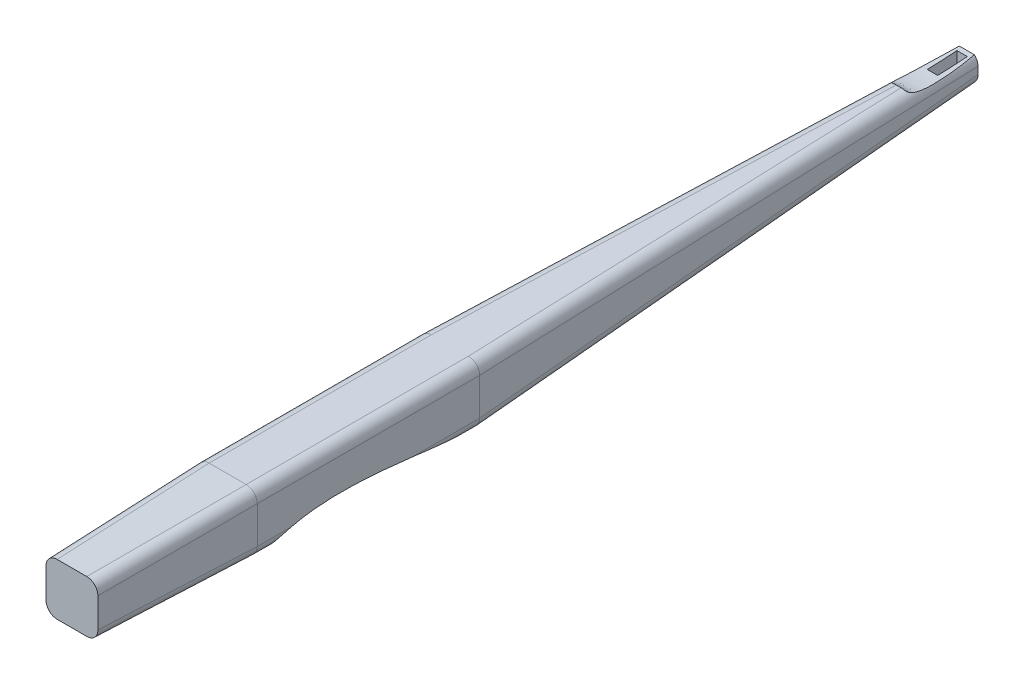
from build123d import *

# Parameters (mm, degrees)
BOSS_EXTRUDE1_DEPTH     = 381
FILLET1_R               = 19.05
CUT_EXTRUDE1_DEPTH      = 1272.5280592341621
CUT_EXTRUDE2_DEPTH      = 1269.4800690080208
CUT_EXTRUDE2_DEPTH_BACK = 1269.4800690080208
CUT_EXTRUDE3_DEPTH      = 37.337999999999994


with BuildPart() as part:
    # Sketch1 → Boss-Extrude1 (new body)
    with BuildSketch(Plane.XY):
        Polygon((50.8, -50.800000000000004), (-50.79999999999999, -50.80000000000001), (-50.79999999999999, 50.79999999999998), (50.800000000000004, 50.79999999999999), align=None)
    extrude(amount=-BOSS_EXTRUDE1_DEPTH)

    # Sketch2 → section 1 of loft1
    with BuildSketch(Plane(origin=(0, 0, -1266.444), x_dir=(-1, 0, 0), z_dir=(0, 0, -1)), mode=Mode.PRIVATE) as loft1_s1:
        with BuildLine():
            Line((19.049999999999997, 1.041e-14), (-19.050000000000008, 6.94e-15))
            Line((-19.050000000000008, 6.94e-15), (-19.050000000000004, 50.8))
            Line((-19.050000000000004, 50.8), (19.049999999999997, 50.800000000000004))
            Line((19.049999999999997, 50.800000000000004), (19.049999999999997, 1.041e-14))
        make_face()
    # loft from a face of the part (loft1)
    loft([part.faces().sort_by_distance((8.97e-15, -7.93e-15, -381))[0], loft1_s1.sketch])

    # Sketch4 → section 1 of loft2
    with BuildSketch(Plane.XY.offset(266.7), mode=Mode.PRIVATE) as loft2_s1:
        with BuildLine():
            Line((44.45, -44.449999999999996), (-44.44999999999999, -44.45000000000001))
            Line((-44.44999999999999, -44.45000000000001), (-44.44999999999999, 44.44999999999998))
            Line((-44.44999999999999, 44.44999999999998), (44.45, 44.45))
            Line((44.45, 44.45), (44.45, -44.449999999999996))
        make_face()
    # loft from a face of the part (loft2)
    loft([part.faces().sort_by_distance((8.97e-15, -7.93e-15, 0))[0], loft2_s1.sketch])

    # Fillet1
    # the kernel refuses this fillet: 19.05 mm, written as the material it takes off along each edge
    with BuildSketch(Plane(origin=(-51.932644394110994, -51.93264439411102, -47.57106455266241), x_dir=(0.9997168342007507, -0.0005664118040792134, -0.023789295771349354), z_dir=(0.023796037813647482, 0.023796037813647454, 0.9994335881731928))) as fillet1_piece_1:
        with BuildLine():
            CenterArc((FILLET1_R * 0.999433588173, FILLET1_R), FILLET1_R, 180.03246219976114, 89.9675378002388)
            Line((-FILLET1_R * 0.000566251324744, FILLET1_R * 0.999433427762), (0, 0))
            Line((0, 0), (FILLET1_R * 0.999433588173, 0))
        make_face()
    fillet1_piece_1_solid = extrude(amount=362.0471969195225, mode=Mode.PRIVATE)
    with BuildSketch(Plane(origin=(-51.932644394111, 51.932644394110994, -47.57106455266237), x_dir=(-0.0005664118040795857, -0.9997168342007507, -0.02378929577134932), z_dir=(0.023796037813647454, -0.023796037813647454, 0.9994335881731928))) as fillet1_piece_2:
        with BuildLine():
            CenterArc((FILLET1_R * 0.999433588173, FILLET1_R), FILLET1_R, 180.03246219976117, 89.9675378002388)
            Line((-FILLET1_R * 0.000566251324744, FILLET1_R * 0.999433427762), (0, 0))
            Line((0, 0), (FILLET1_R * 0.999433588173, 0))
        make_face()
    fillet1_piece_2_solid = extrude(amount=362.04719691952243, mode=Mode.PRIVATE)
    with BuildSketch(Plane(origin=(51.932644394111, -51.932644394111016, -47.57106455266235), x_dir=(-0.9997168342007507, -0.0005664118040795851, -0.02378929577134929), z_dir=(-0.023796037813647426, 0.023796037813647482, 0.9994335881731928))) as fillet1_piece_3:
        with BuildLine():
            CenterArc((FILLET1_R * 0.999433588173, -FILLET1_R), FILLET1_R, 90.00000000000001, 89.96753780023882)
            Line((-FILLET1_R * 0.000566251324744, -FILLET1_R * 0.999433427762), (0, 0))
            Line((0, 0), (FILLET1_R * 0.999433588173, 0))
        make_face()
    fillet1_piece_3_solid = extrude(amount=362.0471969195224, mode=Mode.PRIVATE)
    with BuildSketch(Plane(origin=(51.932644394111016, 51.932644394110994, -47.57106455266235), x_dir=(0.0005664118040795844, -0.9997168342007507, -0.023789295771349268), z_dir=(-0.023796037813647454, -0.023796037813647402, 0.9994335881731928))) as fillet1_piece_4:
        with BuildLine():
            CenterArc((FILLET1_R * 0.999433588173, -FILLET1_R), FILLET1_R, 90.00000000000003, 89.9675378002388)
            Line((-FILLET1_R * 0.000566251324744, -FILLET1_R * 0.999433427762), (0, 0))
            Line((0, 0), (FILLET1_R * 0.999433588173, 0))
        make_face()
    fillet1_piece_4_solid = extrude(amount=362.0471969195224, mode=Mode.PRIVATE)
    with BuildSketch(Plane(origin=(-52.50033508110967, -53.52053612977551, -333.5810552580131), x_dir=(0.9993598364983117, -0.0020491793203177163, 0.035717195553134094), z_dir=(0.035775930373194195, 0.057241488597110736, -0.9977191462476397))) as fillet1_piece_5:
        with BuildLine():
            CenterArc((FILLET1_R * 0.997949557402, -FILLET1_R), FILLET1_R, 89.99999999999999, 89.88239776592327)
            Line((-FILLET1_R * 0.00204833612594, -FILLET1_R * 0.997947455249), (0, 0))
            Line((0, 0), (FILLET1_R * 0.997949557402, 0))
        make_face()
    fillet1_piece_5_solid = extrude(amount=982.5228804827022, mode=Mode.PRIVATE)
    with BuildSketch(Plane(origin=(-50.8, -50.80000000000001, 47.62500000000001), x_dir=(1, 0, 0), z_dir=(0, 0, -1))) as fillet1_piece_6:
        with BuildLine():
            CenterArc((FILLET1_R, -FILLET1_R), FILLET1_R, 90, 90)
            Line((0, -FILLET1_R), (0, 0))
            Line((0, 0), (FILLET1_R, 0))
        make_face()
    fillet1_piece_6_solid = extrude(amount=476.25, mode=Mode.PRIVATE)
    with BuildSketch(Plane(origin=(50.8, -50.800000000000004, 47.625), x_dir=(-1, 0, 0), z_dir=(0, 0, -1))) as fillet1_piece_7:
        with BuildLine():
            CenterArc((FILLET1_R, FILLET1_R), FILLET1_R, 180, 90)
            Line((0, FILLET1_R), (0, 0))
            Line((0, 0), (FILLET1_R, 0))
        make_face()
    fillet1_piece_7_solid = extrude(amount=476.25, mode=Mode.PRIVATE)
    with BuildSketch(Plane(origin=(52.50033508110991, -53.52053612977587, -333.5810552580067), x_dir=(-0.9993598364983117, -0.0020491793203172817, 0.035717195553134094), z_dir=(-0.03577593037319418, 0.05724148859711073, -0.9977191462476397))) as fillet1_piece_8:
        with BuildLine():
            CenterArc((FILLET1_R * 0.997949557402, FILLET1_R), FILLET1_R, 180.11760223406566, 89.88239776593434)
            Line((-FILLET1_R * 0.00204833612567, FILLET1_R * 0.997947455249), (0, 0))
            Line((0, 0), (FILLET1_R * 0.997949557402, 1e-17))
        make_face()
    fillet1_piece_8_solid = extrude(amount=982.5228804827152, mode=Mode.PRIVATE)
    with BuildSketch(Plane(origin=(-52.50662693476485, 50.79999999999998, -333.40558804327765), x_dir=(0.9993577313746022, 0, 0.03583468629427), z_dir=(0.03583468629427, 0, -0.999357731374602))) as fillet1_piece_9:
        with BuildLine():
            CenterArc((FILLET1_R, FILLET1_R), FILLET1_R, 179.99999999997615, 90.00000000002387)
            Line((7.1e-15, FILLET1_R), (0, 0))
            Line((0, 0), (FILLET1_R, 0))
        make_face()
    fillet1_piece_9_solid = extrude(amount=981.2630583891101, mode=Mode.PRIVATE)
    with BuildSketch(Plane(origin=(-50.79999999999999, 50.79999999999998, 47.625), x_dir=(0, -1, 0), z_dir=(0, 0, -1))) as fillet1_piece_10:
        with BuildLine():
            CenterArc((FILLET1_R, -FILLET1_R), FILLET1_R, 90, 90)
            Line((0, -FILLET1_R), (0, 0))
            Line((0, 0), (FILLET1_R, 0))
        make_face()
    fillet1_piece_10_solid = extrude(amount=476.25, mode=Mode.PRIVATE)
    with BuildSketch(Plane(origin=(52.50662693476462, 50.79999999999999, -333.4055880432845), x_dir=(-0.9993577313746019, 0, 0.03583468629427), z_dir=(-0.03583468629427001, 0, -0.999357731374602))) as fillet1_piece_11:
        with BuildLine():
            CenterArc((FILLET1_R, -FILLET1_R), FILLET1_R, 90, 89.99999999997814)
            Line((0, -FILLET1_R), (0, 0))
            Line((0, 0), (FILLET1_R, 0))
        make_face()
    fillet1_piece_11_solid = extrude(amount=981.2630583890963, mode=Mode.PRIVATE)
    with BuildSketch(Plane(origin=(50.800000000000004, 50.79999999999999, 47.62500000000002), x_dir=(0, -1, 0), z_dir=(0, 0, -1))) as fillet1_piece_12:
        with BuildLine():
            CenterArc((FILLET1_R, FILLET1_R), FILLET1_R, 180, 90)
            Line((7.11e-15, FILLET1_R), (0, 0))
            Line((0, 0), (FILLET1_R, 0))
        make_face()
    fillet1_piece_12_solid = extrude(amount=476.25, mode=Mode.PRIVATE)
    add([fillet1_piece_1_solid, fillet1_piece_2_solid, fillet1_piece_3_solid, fillet1_piece_4_solid, fillet1_piece_5_solid, fillet1_piece_6_solid, fillet1_piece_7_solid, fillet1_piece_8_solid, fillet1_piece_9_solid, fillet1_piece_10_solid, fillet1_piece_11_solid, fillet1_piece_12_solid], mode=Mode.SUBTRACT)

    # Sketch5 → Cut-Extrude1 (cut, through all)
    with BuildSketch(Plane(origin=(50.800000000000004, -3.47e-15, 0), x_dir=(0, 0, -1), z_dir=(1, -7e-17, 0))):
        with BuildLine():
            Line((380.99999961091885, -50.72773474398722), (380.99999961091885, -50.90553473072018))
            add(Edge.make_bspline(
                [(380.99999961091885, -50.72773474398722), (379.1199422476244, -50.332059877835945), (375.3629762480609, -49.54137282326303), (369.72147118833135, -48.40782512029006), (364.08383499753637, -47.30358715433574), (358.45045422082046, -46.2277779408739), (352.82296113266807, -45.17586404058043), (347.2026510722475, -44.146171842986405), (339.72951535976017, -42.803289831872085), (328.5708424330486, -40.85572231464945), (315.59486198311583, -38.70617077014065), (302.69044190863667, -36.69416736472734), (291.7279894210285, -35.07324441902657), (277.3081345396814, -33.0582662659366), (263.0217353309379, -31.232793881609453), (248.8855786380547, -29.589158017690778), (238.48101989020577, -28.457420210042475), (228.22006407354522, -27.418602442004648), (218.11299945297515, -26.473679606271595), (208.169967574955, -25.625269521840444), (198.40093814947406, -24.87732542829763), (187.27677028098833, -24.131460518021168), (174.89300262723722, -23.460728421472393), (161.3521311192931, -22.96580443634496), (148.30819608339323, -22.745693436254452), (135.79088696224778, -22.804356190598735), (125.07352326286886, -23.103496239466928), (116.06926648435135, -23.54176121095195), (108.68126438941633, -24.027845586323405), (101.56742260715468, -24.622279981261325), (94.73490893207381, -25.3193892247374), (88.1905972483912, -26.1130588056706), (81.94104657946905, -26.996875830206733), (75.99251835082035, -27.964240254710525), (70.3509873903062, -29.00838352959375), (65.02209486588997, -30.12235140592801), (60.78553261907261, -31.117149668003044), (56.81172877696402, -32.13489555531044), (53.79488310329989, -32.972993032134916), (50.8949697068487, -33.85020829916906), (48.83945541944608, -34.50736971277029), (46.86752216330076, -35.17385208964856), (44.97966270247442, -35.84876547161597), (43.17634219781936, -36.53122667445018), (41.45800765577137, -37.220388258919925), (39.825078093117135, -37.91542292774213), (38.27794918495912, -38.61553797054179), (36.816999385212846, -39.31999745074257), (35.44256770809629, -40.02808489823564), (34.154989168189395, -40.739180134350065), (32.95455129168436, -41.45268132048107), (31.841529765870686, -42.16807775733227), (30.816168902129423, -42.884925914429154), (29.878687676729417, -43.602853862431786), (29.02928412966161, -44.32157680088244), (28.268138039874206, -45.040892971185514), (27.595429461276666, -45.76070124171166), (27.01133858716883, -46.48097994043837), (26.516092175249714, -47.201796639451445), (26.109961908598677, -47.9232728347379), (25.79337357416429, -48.64552942184157), (25.56657221996545, -49.36860994933056), (25.430771238757277, -50.09241858334018), (25.384890306763435, -50.79741841012291), (25.430071273926526, -51.48296493076648), (25.5666933260267, -52.146715958229386), (25.79320496246965, -52.80549004281098), (26.10985586945496, -53.45708589149039), (26.51602463784535, -54.09956383760533), (27.01139694506271, -54.73119008892568), (27.595670672888545, -55.350393785460355), (28.268608762343902, -55.95575812469804), (29.030011662020218, -56.545992911990574), (29.87969016831047, -57.1199502039969), (30.817451871965336, -57.67662370160325), (31.843088355229636, -58.215172602556976), (32.956369526852995, -58.734917244481146), (34.157050039479515, -59.23532657405106), (35.44484935146459, -59.71604392285356), (36.81947306335572, -60.1768351286887), (38.28059029980787, -60.61763913279932), (39.8278565019578, -61.03848216073298), (41.46089630995408, -61.43951997707636), (43.17931403488939, -61.8209839234251), (44.98268961574996, -62.183181892092925), (46.870581370366644, -62.52645849494935), (48.84252444626457, -62.85118911126551), (50.898029050413776, -63.157777307831935), (53.03658627621604, -63.44660229331993), (55.257664668875165, -63.71802993557078), (57.56071168471064, -63.9723974564279), (60.79223110063348, -64.29440037721055), (65.03285770804884, -64.65275787205728), (70.36100548678037, -65.01181704474757), (76.00174294761769, -65.30705283539069), (81.9494552696848, -65.5384825939226), (88.19818091805858, -65.70594552335209), (94.74165655141265, -65.80946384303958), (101.57330974314227, -65.84965984783297), (108.68625362844652, -65.82803709426076), (116.07331623590423, -65.74718643949083), (123.72705736690936, -65.61073809948286), (131.63979436498684, -65.42315179019752), (139.80357823064844, -65.18933934778669), (148.2102033975997, -64.91416872065597), (156.85122663739253, -64.60188071224269), (165.71796559347285, -64.2556509826232), (174.80150591902066, -63.877180567405894), (187.32064344703653, -63.32394344724253), (200.09709938827254, -62.709203643629515), (213.1176001224968, -62.02577155777383), (223.14378994198248, -61.468740761597246), (233.32886768148387, -60.87196898081725), (245.4250689475014, -60.12940437921654), (257.67884824754105, -59.34135190815975), (270.07834278960473, -58.524080876235445), (280.8494932757496, -57.80881102630849), (289.89051897884144, -57.2098207788568), (299.0088069002602, -56.60894931910878), (308.1952057520071, -56.00681363490311), (319.27179825488196, -55.28120575473243), (328.5428701137698, -54.665033745613925), (335.98777513795574, -54.15760541719399), (341.5895640642509, -53.76780062769398), (347.20124345639937, -53.368112792353536), (352.8213774309493, -52.95832602519767), (358.44852093019364, -52.539831923914306), (364.08122078910833, -52.11574031390458), (369.71808319724624, -51.69368128355833), (375.3574176491243, -51.2795955226476), (379.11919514541586, -51.03021793649175), (380.99999961091885, -50.90553473072018)],
                knots=[0, 0, 0, 0, 0.00794054253800827, 0.01586778622600444, 0.02378233552950115, 0.03168384182053088, 0.03957146571772121, 0.04744380534383056, 0.05529940664952229, 0.07095290742530115, 0.09425996566421788, 0.10965974875933507, 0.12493136750880234, 0.14006047494894722, 0.16983616684280972, 0.18445593803517132, 0.19887898784767633, 0.21309198080825337, 0.22708136379037092, 0.24083373334846994, 0.2543358963460655, 0.26757489779677823, 0.2869130181854083, 0.30559175715739273, 0.3235747509696821, 0.34082886199436485, 0.35732353106631737, 0.3678840264564878, 0.3780864617316414, 0.3879232340828391, 0.3973870152361961, 0.40647079718974904, 0.41516795038909715, 0.42347224363159164, 0.431377770088885, 0.43887902172484355, 0.445971138884747, 0.4493623306482941, 0.45583251443119055, 0.458910652184174, 0.4618836692698341, 0.4647512720198068, 0.4675132472268217, 0.4701694590506992, 0.4727198717711611, 0.47516456687460396, 0.477503761569343, 0.4797378262835055, 0.48186733255789, 0.48389308371212414, 0.4858161516843719, 0.48763795122137477, 0.48936030277270776, 0.49098553002107564, 0.49251654217606516, 0.49395700356015, 0.4953114660069481, 0.496585560552849, 0.497786200428971, 0.4989217869569204, 0.5000023522201438, 0.5010396398111192, 0.5020469866700766, 0.5030389949085485, 0.5039517308379784, 0.5048781580306005, 0.5058313926613106, 0.5068235757246394, 0.5078656030081089, 0.5089670319717817, 0.5101361065504422, 0.5113798847914282, 0.5127043710176186, 0.514114660263003, 0.5156150931176903, 0.5172093484465349, 0.518900571097045, 0.5206914185444694, 0.5225841438672096, 0.5245806378828378, 0.5266824777493629, 0.5288909638332169, 0.5312071332127252, 0.533631806027993, 0.536165598839476, 0.5388089372536621, 0.5415620810869926, 0.5444251467303854, 0.5473981080109196, 0.5504808170740686, 0.553673026528163, 0.5569743852018338, 0.5639027331351082, 0.5712613808885695, 0.579045037483656, 0.5872474200685028, 0.5958615947253272, 0.6048800980324515, 0.6142948710544515, 0.6240972607482332, 0.6342780556459107, 0.644827521987638, 0.6557353553003363, 0.666990798757914, 0.678582536023013, 0.6904988427249865, 0.7027277886542711, 0.7152570415497626, 0.7280740470626968, 0.7545203774032196, 0.7681235706978663, 0.7819623510740769, 0.7960229044900302, 0.8102910848201407, 0.8320505413451346, 0.8467728744077202, 0.8616499263988447, 0.8766662189492966, 0.8842217426981368, 0.8994179406763128, 0.9147154752074859, 0.9300998996202058, 0.9378202024662631, 0.94555696886631, 0.9533083122389343, 0.9610722588770454, 0.9688468787347696, 0.976629764477321, 0.984418333857866, 0.9922095160362372, 1, 1, 1, 1], degree=3))
        make_face()
    extrude(amount=-CUT_EXTRUDE1_DEPTH, mode=Mode.SUBTRACT)

    # Sketch7 → Cut-Extrude2 (cut, two sides: drawn at the far end of the back side and taken through both)
    with BuildSketch(Plane(origin=(0, 0, 0), x_dir=(0, 0, -1), z_dir=(1, 0, 0)).offset(-CUT_EXTRUDE2_DEPTH_BACK)):
        with BuildLine():
            Line((1315.974, 50.97468840370302), (1315.974, 50.625311596296946))
            add(Edge.make_bspline(
                [(1315.974, 50.97468840370302), (1313.2015834226888, 51.29285812510612), (1307.65868144519, 51.92897594101384), (1296.569912417057, 53.110994181689904), (1282.7087088416397, 54.46953212992223), (1266.0706670910379, 55.90927613882299), (1249.4340107380433, 57.165174869243145), (1232.7969548013562, 58.18906014730363), (1216.1588108419414, 58.91757581253349), (1202.288616675421, 59.1724018265426), (1191.1944532504192, 59.07160186574986), (1182.8719536255348, 58.79786075969515), (1174.5435280135694, 58.26961082515002), (1167.6084991311366, 57.533815397038225), (1162.0587961822698, 56.651701808290106), (1157.8876615232818, 55.79033316196768), (1154.3412168467219, 54.69592723591928), (1151.4000139356792, 53.457814378474666), (1148.5406347967933, 50.800000000000004), (1151.4000139356795, 48.14218562152529), (1154.3412168467219, 46.904072764080745), (1157.8876615232818, 45.80966683803228), (1162.0587961822698, 44.94829819170985), (1167.6084991311366, 44.06618460296179), (1174.5435280135694, 43.33038917484994), (1182.8719536255348, 42.80213924030481), (1191.1944532504192, 42.5283981342501), (1202.288616675421, 42.42759817345741), (1216.1588108419414, 42.68242418746653), (1232.7969548013562, 43.41093985269628), (1249.4340107380433, 44.43482513075682), (1266.0706670910379, 45.69072386117697), (1282.7087088416397, 47.130467870077744), (1296.569912417057, 48.48900581831006), (1307.65868144519, 49.671024058986184), (1313.2015834226888, 50.30714187489384), (1315.974, 50.625311596296946)],
                knots=[0, 0, 0, 0, 0.0248235560251693, 0.04962982075151177, 0.09919708005334574, 0.1487126528835163, 0.19818213977408347, 0.24760447283719364, 0.2969799429286886, 0.3463175958334698, 0.37098429816999906, 0.3956640197872506, 0.4203821816762908, 0.4451980506804865, 0.4576892092236575, 0.4703042827928557, 0.48322922960192505, 0.4900691736525998, 0.4999999999999999, 0.5099308263474, 0.5167707703980747, 0.5296957172071441, 0.5423107907763423, 0.5548019493195133, 0.579617818323709, 0.6043359802127491, 0.6290157018300008, 0.65368240416653, 0.7030200570713111, 0.7523955271628062, 0.8018178602259164, 0.8512873471164837, 0.9008029199466542, 0.9503701792484882, 0.9751764439748306, 1, 1, 1, 1], degree=3))
        make_face()
    extrude(amount=CUT_EXTRUDE2_DEPTH + CUT_EXTRUDE2_DEPTH_BACK, mode=Mode.SUBTRACT)

    # Sketch8 → Cut-Extrude3 (cut)
    with BuildSketch(Plane(origin=(-3.47e-15, 50.79999999999998, 0), x_dir=(1, 7e-17, 0), z_dir=(-7e-17, 1, 0))):
        Polygon((8.89000000000004, 1258.3160917113864), (-8.889999999999956, 1258.3160917113864), (-8.88999999999995, 1207.5160917113865), (8.890000000000047, 1207.5160917113865), align=None)
    extrude(amount=-CUT_EXTRUDE3_DEPTH, mode=Mode.SUBTRACT)


solid = part.part
